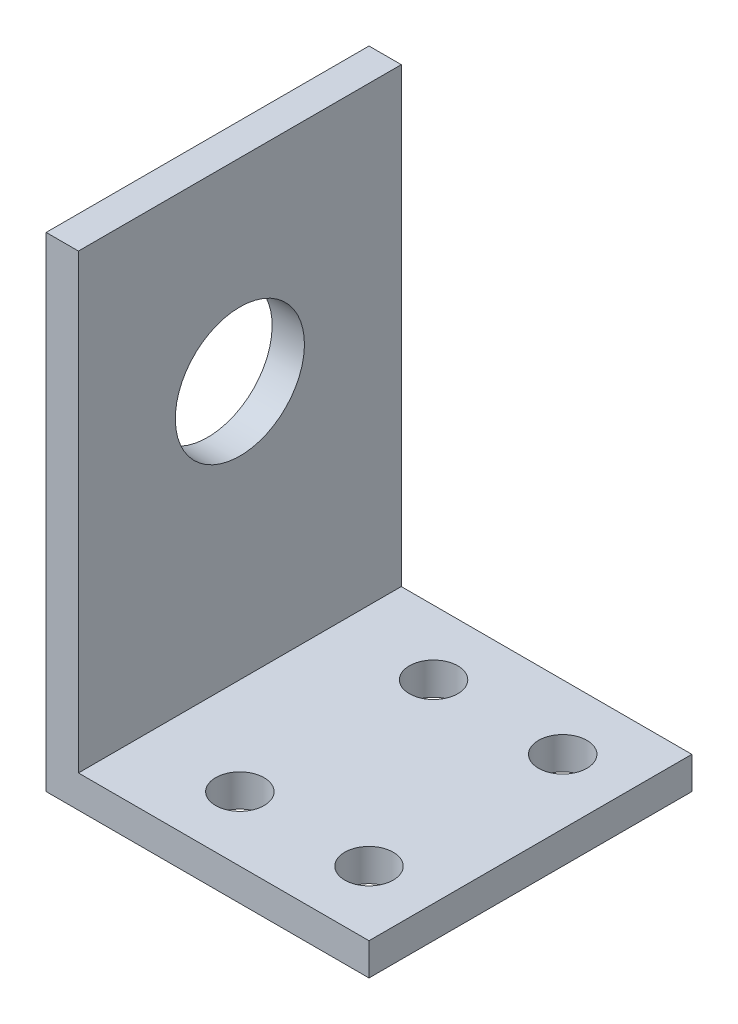
from build123d import *

# Parameters (mm, degrees)
EXTRUDE_1_DEPTH     = 20
SKETCH_2_R          = 1.5
CUT_EXTRUDE_1_DEPTH = 46
SKETCH_3_R          = 4
CUT_EXTRUDE_2_DEPTH = 47.184412955
SKETCH_4_R          = 1.5
CUT_EXTRUDE_3_DEPTH = 20
SKETCH_5_W          = 3
SKETCH_5_H          = 20
CUT_EXTRUDE_4_DEPTH = 8
SKETCH_6_W          = 20
SKETCH_6_H          = 27
CUT_EXTRUDE_5_DEPTH = 1
SKETCH_7_W          = 18
SKETCH_7_H          = 20
CUT_EXTRUDE_6_DEPTH = 1


with BuildPart() as part:
    # 草图1 → 凸台-拉伸1 (new body)
    with BuildSketch(Plane.XY):
        Polygon((0, 0), (0, 38), (3, 38), (3, 3), (20, 3), (20, 0), align=None)
    extrude(amount=EXTRUDE_1_DEPTH)

    # 草图2 → 切除-拉伸1 (cut, through all)
    with BuildSketch(Plane(origin=(0, 3, 0), x_dir=(1, 0, 0), z_dir=(0, 1, 0))):
        with Locations((16, -16)):
            Circle(SKETCH_2_R)
        with Locations((16, -4)):
            Circle(SKETCH_2_R)
    extrude(amount=-CUT_EXTRUDE_1_DEPTH, mode=Mode.SUBTRACT)

    # 草图3 → 切除-拉伸2 (cut, through all)
    with BuildSketch(Plane(origin=(3, 0, 0), x_dir=(0, 0, -1), z_dir=(1, 0, 0))):
        with Locations((-10, 18)):
            Circle(SKETCH_3_R)
    extrude(amount=-CUT_EXTRUDE_2_DEPTH, mode=Mode.SUBTRACT)

    # 草图4 → 切除-拉伸3 (cut)
    with BuildSketch(Plane(origin=(0, 3, 0), x_dir=(1, 0, 0), z_dir=(0, 1, 0))):
        with Locations((8, -16)):
            Circle(SKETCH_4_R)
        with Locations((8, -4)):
            Circle(SKETCH_4_R)
    extrude(amount=-CUT_EXTRUDE_3_DEPTH, mode=Mode.SUBTRACT)

    # 草图5 → 切除-拉伸4 (cut)
    with BuildSketch(Plane(origin=(0, 38, 0), x_dir=(1, 0, 0), z_dir=(0, 1, 0))):
        with Locations((1.5, -10)):
            Rectangle(SKETCH_5_W, SKETCH_5_H)
    extrude(amount=-CUT_EXTRUDE_4_DEPTH, mode=Mode.SUBTRACT)

    # 草图6 → 切除-拉伸5 (cut)
    with BuildSketch(Plane(origin=(3, 0, 0), x_dir=(0, 0, -1), z_dir=(1, 0, 0))):
        with Locations((-10, 16.5)):
            Rectangle(SKETCH_6_W, SKETCH_6_H)
    extrude(amount=-CUT_EXTRUDE_5_DEPTH, mode=Mode.SUBTRACT)

    # 草图7 → 切除-拉伸6 (cut)
    with BuildSketch(Plane(origin=(0, 3, 0), x_dir=(1, 0, 0), z_dir=(0, 1, 0))):
        with Locations((11, -10)):
            Rectangle(SKETCH_7_W, SKETCH_7_H)
    extrude(amount=-CUT_EXTRUDE_6_DEPTH, mode=Mode.SUBTRACT)


solid = part.part
